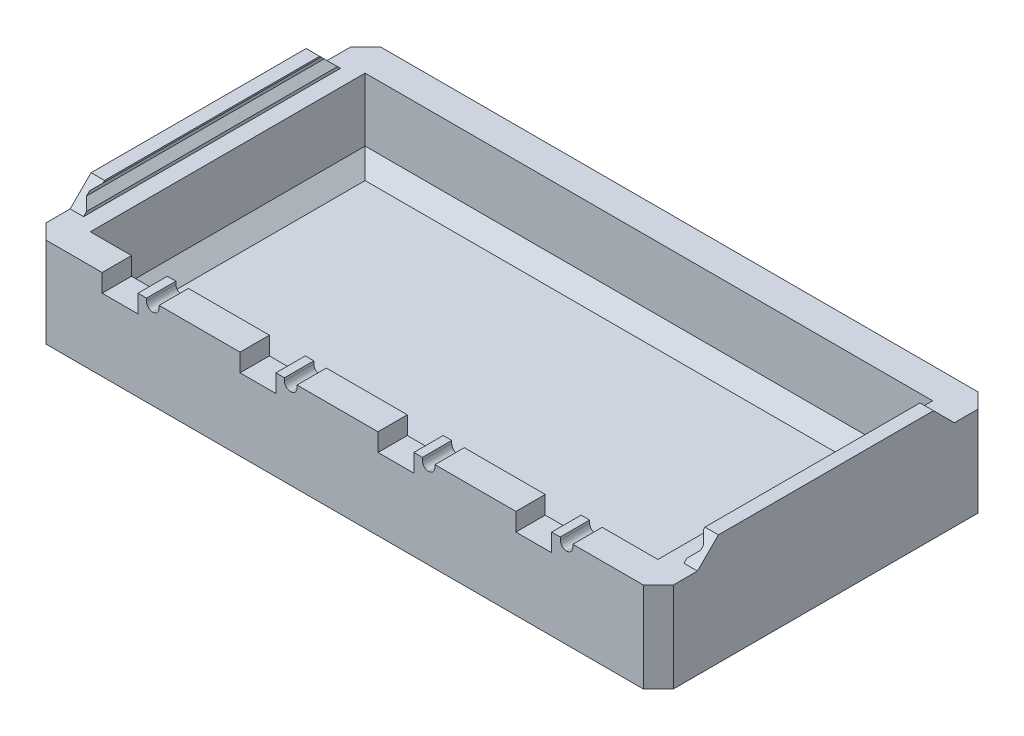
from build123d import *

# Parameters (mm, degrees)
SKETCH1_W           = 210
SKETCH1_H           = 112
SKETCH1_W_2         = 190
SKETCH1_H_2         = 92
BOSS_EXTRUDE1_DEPTH = 30.16
SKETCH2_W           = 210
SKETCH2_H           = 112
BOSS_EXTRUDE2_DEPTH = 4
BOSS_EXTRUDE3_DEPTH = 4.5
SKETCH5_W           = 12
SKETCH5_H           = 6
CUT_EXTRUDE2_DEPTH  = 14.5
SKETCH6_W           = 4.2
SKETCH6_H           = 3
CUT_EXTRUDE3_DEPTH  = 14.5
CHAMFER1_SIZE       = 5
CHAMFER2_SIZE       = 5
CUT_EXTRUDE4_DEPTH  = 100
FILLET1_R           = 2.1


with BuildPart() as part:
    # Sketch1 → Boss-Extrude1 (new body)
    with BuildSketch(Plane(origin=(0, 0, 0), x_dir=(1, 0, 0), z_dir=(0, 1, 0))):
        with Locations((0, 0.169761006)):
            Rectangle(SKETCH1_W, SKETCH1_H)
        Rectangle(SKETCH1_W_2, SKETCH1_H_2, mode=Mode.SUBTRACT)
    extrude(amount=BOSS_EXTRUDE1_DEPTH)

    # Sketch2 → Boss-Extrude2 (add)
    with BuildSketch(Plane.XZ):
        with Locations((0, -0.169761006)):
            Rectangle(SKETCH2_W, SKETCH2_H)
    extrude(amount=-BOSS_EXTRUDE2_DEPTH)

    # Sketch3 → Boss-Extrude3 (add)
    with BuildSketch(Plane(origin=(105, 0, 0), x_dir=(0, 0, -1), z_dir=(1, 0, 0))):
        Polygon((-42.738491713, 30.16), (43.261508287, 30.16), (36.261508287, 37.16), (-35.738491713, 37.16), align=None)
    boss_extrude3 = extrude(amount=-BOSS_EXTRUDE3_DEPTH)

    # Sketch5 → Cut-Extrude2 (cut)
    with BuildSketch(Plane.XY.offset(55.830238994)):
        with Locations((63.3, 27.16)):
            Rectangle(SKETCH5_W, SKETCH5_H)
        with Locations((17.13, 27.16)):
            Rectangle(SKETCH5_W, SKETCH5_H)
        with Locations((-29.04, 27.16)):
            Rectangle(SKETCH5_W, SKETCH5_H)
        with Locations((-75.21, 27.16)):
            Rectangle(SKETCH5_W, SKETCH5_H)
    extrude(amount=-CUT_EXTRUDE2_DEPTH, mode=Mode.SUBTRACT)

    # Sketch6 → Cut-Extrude3 (cut)
    with BuildSketch(Plane.XY.offset(55.830238994)):
        with Locations((-64.25, 28.66)):
            Rectangle(SKETCH6_W, SKETCH6_H)
        with Locations((-18.08, 28.66)):
            Rectangle(SKETCH6_W, SKETCH6_H)
        with Locations((28.09, 28.66)):
            Rectangle(SKETCH6_W, SKETCH6_H)
        with Locations((74.26, 28.66)):
            Rectangle(SKETCH6_W, SKETCH6_H)
    extrude(amount=-CUT_EXTRUDE3_DEPTH, mode=Mode.SUBTRACT)

    # Chamfer1
    chamfer1_edges = [part.edges().sort_by_distance(p)[0] for p in [
        (0, 4, -46),
        (0, 4, 46),
        (-95, 4, 0),
        (95, 4, 0),
    ]]
    chamfer(chamfer1_edges, length=CHAMFER1_SIZE)

    # Chamfer2
    chamfer2_edges = [part.edges().sort_by_distance(p)[0] for p in [
        (105, 15.08, 55.830238994),
        (-105, 15.08, 55.830238994),
        (-105, 15.08, -56.169761006),
        (105, 15.08, -56.169761006),
    ]]
    chamfer(chamfer2_edges, length=CHAMFER2_SIZE)

    # Sketch7 → Cut-Extrude4 (cut)
    with BuildSketch(Plane.XY.offset(55.830238994)):
        Polygon((100.5, 36.66), (102.75, 34.41), (102.75, 33.41), (100.5, 31.16), align=None)
    cut_extrude4 = extrude(amount=-CUT_EXTRUDE4_DEPTH, mode=Mode.SUBTRACT)

    # Mirror1: Boss-Extrude3, Cut-Extrude4 across plane
    add(boss_extrude3.mirror(Plane(origin=(0, 0, 0), x_dir=(0, 0, 1), z_dir=(1, 0, 0))))
    add(cut_extrude4.mirror(Plane(origin=(0, 0, 0), x_dir=(0, 0, 1), z_dir=(1, 0, 0))), mode=Mode.SUBTRACT)

    # Fillet1
    fillet1_edges = [part.edges().sort_by_distance(p)[0] for p in [
        (76.36, 27.16, 50.915119497),
        (30.19, 27.16, 50.915119497),
        (-15.98, 27.16, 50.915119497),
        (-62.15, 27.16, 50.915119497),
        (72.16, 27.16, 50.915119497),
        (25.99, 27.16, 50.915119497),
        (-20.18, 27.16, 50.915119497),
        (-66.35, 27.16, 50.915119497),
    ]]
    fillet(fillet1_edges, radius=FILLET1_R - 0.0001)  # a hair under: the kernel refuses the full size


solid = part.part
